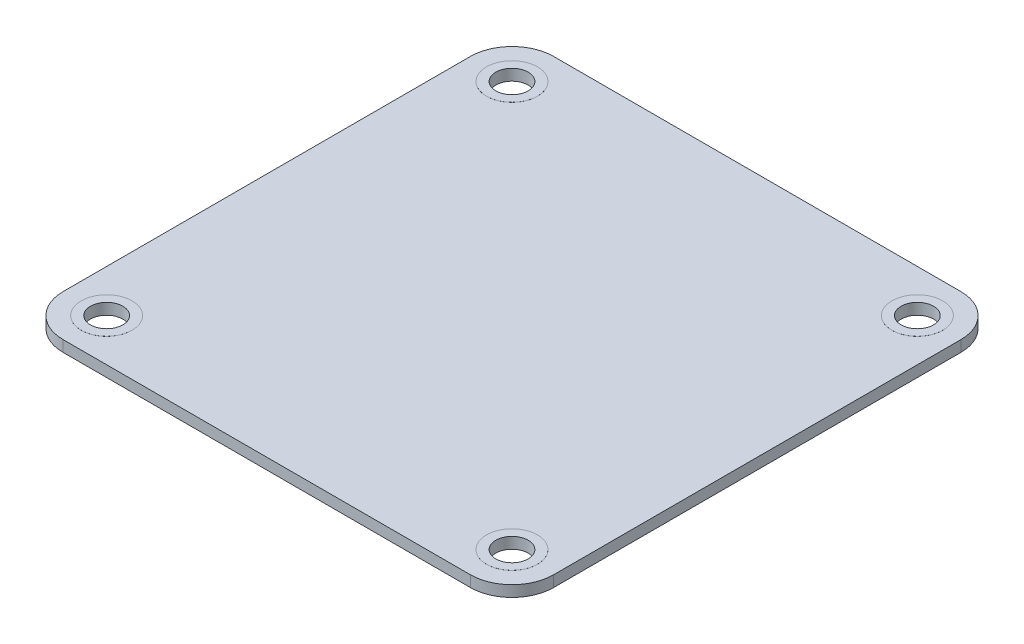
from build123d import *

# Parameters (mm, degrees)
SKETCH1_R           = 1.755
BOSS_EXTRUDE1_DEPTH = 1.2
BOSS_EXTRUDE2_START = 0.6
SKETCH2_R           = 2.75
SKETCH2_R_2         = 1.75
BOSS_EXTRUDE2_DEPTH = 0.605


with BuildPart() as part:
    # Sketch1 → Boss-Extrude1 (new body)
    with BuildSketch(Plane(origin=(0, 0, 0), x_dir=(1, 0, 0), z_dir=(0, 1, 0))):
        with BuildLine():
            Line((22, -26.5), (-22, -26.5))
            ThreePointArc((-22, -26.5), (-25.181980515, -25.181980515), (-26.5, -22))
            Line((-26.5, -22), (-26.5, 22))
            ThreePointArc((-26.5, 22), (-25.181980515, 25.181980515), (-22, 26.5))
            Line((-22, 26.5), (22, 26.5))
            ThreePointArc((22, 26.5), (25.181980515, 25.181980515), (26.5, 22))
            Line((26.5, 22), (26.5, -22))
            ThreePointArc((26.5, -22), (25.181980515, -25.181980515), (22, -26.5))
        make_face()
        with Locations((-21.9, 21.9)):
            Circle(SKETCH1_R, mode=Mode.SUBTRACT)
        with Locations((21.9, 21.9)):
            Circle(SKETCH1_R, mode=Mode.SUBTRACT)
        with Locations((-21.9, -21.9)):
            Circle(SKETCH1_R, mode=Mode.SUBTRACT)
        with Locations((21.9, -21.9)):
            Circle(SKETCH1_R, mode=Mode.SUBTRACT)
    extrude(amount=BOSS_EXTRUDE1_DEPTH)

    # Sketch2 → Boss-Extrude2 (add, symmetric)
    # profile 1 of 4: a face of its own
    with BuildSketch(Plane(origin=(0, 0, 0), x_dir=(1, 0, 0), z_dir=(0, 1, 0)).offset(BOSS_EXTRUDE2_START)):
        with Locations((-21.9, 21.9)):
            Circle(SKETCH2_R)
        with Locations((-21.9, 21.9)):
            Circle(SKETCH2_R_2, mode=Mode.SUBTRACT)
    # profile 2 of 4: a face of its own
    with BuildSketch(Plane(origin=(0, 0, 0), x_dir=(1, 0, 0), z_dir=(0, 1, 0)).offset(BOSS_EXTRUDE2_START)):
        with Locations((21.9, 21.9)):
            Circle(SKETCH2_R)
        with Locations((21.9, 21.9)):
            Circle(SKETCH2_R_2, mode=Mode.SUBTRACT)
    # profile 3 of 4: a face of its own
    with BuildSketch(Plane(origin=(0, 0, 0), x_dir=(1, 0, 0), z_dir=(0, 1, 0)).offset(BOSS_EXTRUDE2_START)):
        with Locations((21.9, -21.9)):
            Circle(SKETCH2_R)
        with Locations((21.9, -21.9)):
            Circle(SKETCH2_R_2, mode=Mode.SUBTRACT)
    # profile 4 of 4: a face of its own
    with BuildSketch(Plane(origin=(0, 0, 0), x_dir=(1, 0, 0), z_dir=(0, 1, 0)).offset(BOSS_EXTRUDE2_START)):
        with Locations((-21.9, -21.9)):
            Circle(SKETCH2_R)
        with Locations((-21.9, -21.9)):
            Circle(SKETCH2_R_2, mode=Mode.SUBTRACT)
    extrude(amount=BOSS_EXTRUDE2_DEPTH, both=True)


solid = part.part
